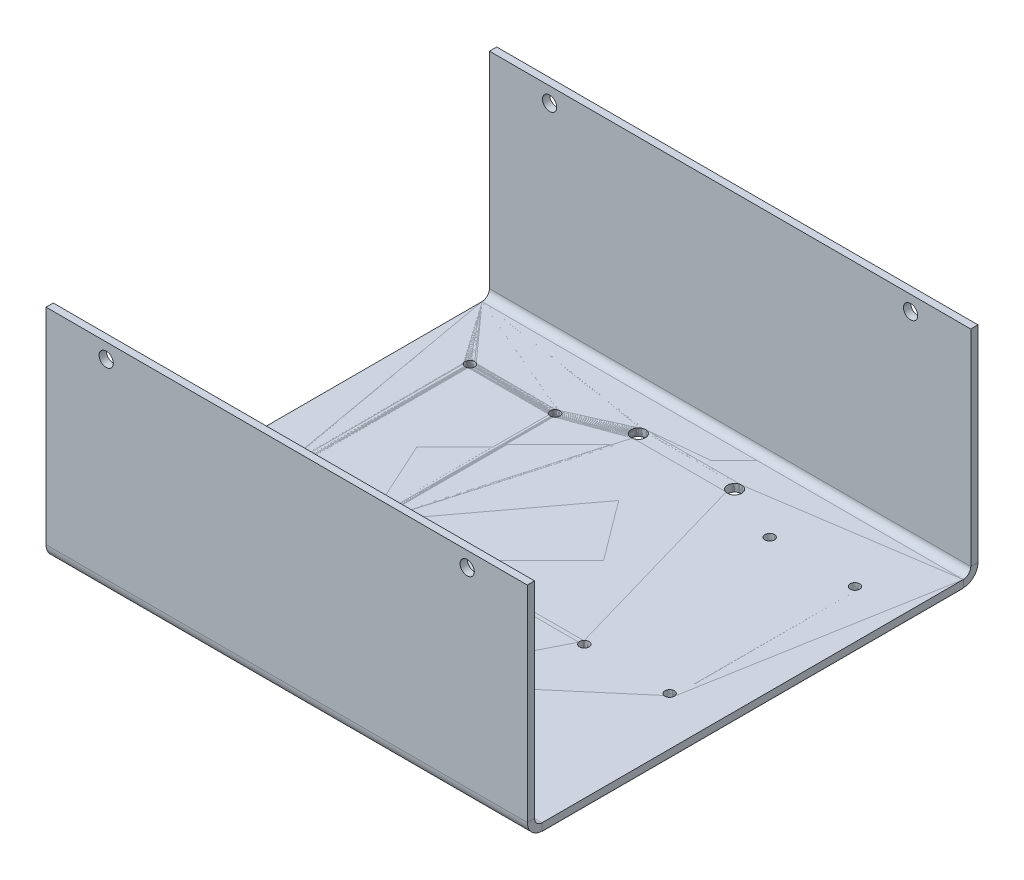
from build123d import *

# Parameters (mm, degrees)
ESQUISSE1_W                      = 101.6
ESQUISSE1_H                      = 88.9
ESQUISSE1_R                      = 1.5
ESQUISSE1_R_2                    = 1
BOSS_EXTRU_1_DEPTH               = 1.5875
CONVERTIR_VOLUME1_START          = 0.0635
CONVERTIR_VOLUME1_OUTLINE_W      = 101.6
CONVERTIR_VOLUME1_OUTLINE_H      = 88.9
CONVERTIR_VOLUME1_OUTLINE_R      = 1.5
CONVERTIR_VOLUME1_OUTLINE_R_2    = 1
CONVERTIR_VOLUME1_DEPTH          = 1.524
T_LE_PLI_E_SUR_AR_TE1_DEPTH      = 101.6
T_LE_START                       = 1.524
T_LE_PLI_E_SUR_AR_TE1_PROFILE_W  = 101.6
T_LE_PLI_E_SUR_AR_TE1_PROFILE_H  = 43.4125
T_LE_PLI_E_SUR_AR_TE1_PROFILE_R  = 1.5
T_LE_PLI_E_SUR_AR_TE1_FLAT_DEPTH = 1.524
T_LE_PLI_E_SUR_AR_TE2_DEPTH      = 101.6
T_LE_PLI_E_SUR_AR_TE2_PROFILE_W  = 101.6
T_LE_PLI_E_SUR_AR_TE2_PROFILE_H  = 43.4125
T_LE_PLI_E_SUR_AR_TE2_PROFILE_R  = 1.5
T_LE_PLI_E_SUR_AR_TE2_FLAT_DEPTH = 1.524


# Read off the part's stored shape, not the designer's step: Convertir-Volume1
# Sheet-metal steps are written as plain solids
with BuildPart() as part:
    # Esquisse1 → Boss.-Extru.1 (new body)
    with BuildSketch(Plane(origin=(0, 0, 0), x_dir=(1, 0, 0), z_dir=(0, 1, 0))):
        with Locations((53.023636364, 35.56)):
            Rectangle(ESQUISSE1_W, ESQUISSE1_H)
        with Locations(Location((63.183636364, 72.39, 0), (0, 0, 270))):
            Circle(ESQUISSE1_R, mode=Mode.SUBTRACT)
        with Locations(Location((63.183636364, 2.54, 0), (0, 0, 270))):
            Circle(ESQUISSE1_R, mode=Mode.SUBTRACT)
        with Locations(Location((75.663636364, 67.31, 0), (0, 0, 270))):
            Circle(ESQUISSE1_R_2, mode=Mode.SUBTRACT)
        with Locations(Location((93.663636364, 67.31, 0), (0, 0, 270))):
            Circle(ESQUISSE1_R_2, mode=Mode.SUBTRACT)
        with Locations(Location((93.663636364, 28.194, 0), (0, 0, 270))):
            Circle(ESQUISSE1_R_2, mode=Mode.SUBTRACT)
        with Locations(Location((75.663636364, 28.194, 0), (0, 0, 270))):
            Circle(ESQUISSE1_R_2, mode=Mode.SUBTRACT)
        with Locations(Location((42.863636364, 2.54, 0), (0, 0, 90))):
            Circle(ESQUISSE1_R, mode=Mode.SUBTRACT)
        with Locations(Location((12.383636364, 28.194, 0), (0, 0, 90))):
            Circle(ESQUISSE1_R_2, mode=Mode.SUBTRACT)
        with Locations(Location((30.383636364, 28.194, 0), (0, 0, 90))):
            Circle(ESQUISSE1_R_2, mode=Mode.SUBTRACT)
        with Locations(Location((12.383636364, 67.31, 0), (0, 0, 90))):
            Circle(ESQUISSE1_R_2, mode=Mode.SUBTRACT)
        with Locations(Location((30.383636364, 67.31, 0), (0, 0, 90))):
            Circle(ESQUISSE1_R_2, mode=Mode.SUBTRACT)
        with Locations(Location((42.863636364, 72.39, 0), (0, 0, 90))):
            Circle(ESQUISSE1_R, mode=Mode.SUBTRACT)
    extrude(amount=BOSS_EXTRU_1_DEPTH)


with BuildPart() as body_2:
    # Convertir-Volume1 outline → Convertir-Volume1 (new body)
    with BuildSketch(Plane(origin=(0, 0, 0), x_dir=(1, 0, 0), z_dir=(0, 1, 0)).offset(CONVERTIR_VOLUME1_START)):
        with Locations((53.023636364, 35.56)):
            Rectangle(CONVERTIR_VOLUME1_OUTLINE_W, CONVERTIR_VOLUME1_OUTLINE_H)
        with Locations((42.863636364, 2.54)):
            Circle(CONVERTIR_VOLUME1_OUTLINE_R, mode=Mode.SUBTRACT)
        with Locations((12.383636364, 28.194)):
            Circle(CONVERTIR_VOLUME1_OUTLINE_R_2, mode=Mode.SUBTRACT)
        with Locations((30.383636364, 28.194)):
            Circle(CONVERTIR_VOLUME1_OUTLINE_R_2, mode=Mode.SUBTRACT)
        with Locations((63.183636364, 2.54)):
            Circle(CONVERTIR_VOLUME1_OUTLINE_R, mode=Mode.SUBTRACT)
        with Locations((75.663636364, 28.194)):
            Circle(CONVERTIR_VOLUME1_OUTLINE_R_2, mode=Mode.SUBTRACT)
        with Locations((93.663636364, 28.194)):
            Circle(CONVERTIR_VOLUME1_OUTLINE_R_2, mode=Mode.SUBTRACT)
        with Locations((12.383636364, 67.31)):
            Circle(CONVERTIR_VOLUME1_OUTLINE_R_2, mode=Mode.SUBTRACT)
        with Locations((30.383636364, 67.31)):
            Circle(CONVERTIR_VOLUME1_OUTLINE_R_2, mode=Mode.SUBTRACT)
        with Locations((42.863636364, 72.39)):
            Circle(CONVERTIR_VOLUME1_OUTLINE_R, mode=Mode.SUBTRACT)
        with Locations((75.663636364, 67.31)):
            Circle(CONVERTIR_VOLUME1_OUTLINE_R_2, mode=Mode.SUBTRACT)
        with Locations((63.183636364, 72.39)):
            Circle(CONVERTIR_VOLUME1_OUTLINE_R, mode=Mode.SUBTRACT)
        with Locations((93.663636364, 67.31)):
            Circle(CONVERTIR_VOLUME1_OUTLINE_R_2, mode=Mode.SUBTRACT)
    extrude(amount=CONVERTIR_VOLUME1_DEPTH)

    # Tôle pliée sur arête1 bend section (across the edge) → Tôle pliée sur arête1 (add)
    with BuildSketch(Plane(origin=(2.223636364, 1.5875, 10.4775), x_dir=(0, 0, -1), z_dir=(1, 0, 0))):
        with BuildLine():
            Line((-1.524, 1.5875), (0, 1.5875))
            ThreePointArc((0, 1.5875), (0.464967985, 0.464967985), (1.5875, 0))
            Line((1.5875, 0), (1.5875, -1.524))
            ThreePointArc((1.5875, -1.524), (-0.61266275, -0.61266275), (-1.524, 1.5875))
        make_face()
    extrude(amount=T_LE_PLI_E_SUR_AR_TE1_DEPTH)

    # Tôle pliée sur arête1 profile (on flange) → Tôle pliée sur arête1 flat (add)
    with BuildSketch(Plane(origin=(0, 1.5875, 10.4775), x_dir=(1, 0, 0), z_dir=(0, 0, 1)).offset(T_LE_START)):
        with Locations((53.023636364, 23.29375)):
            Rectangle(T_LE_PLI_E_SUR_AR_TE1_PROFILE_W, T_LE_PLI_E_SUR_AR_TE1_PROFILE_H)
        with Locations((14.923636364, 41.825)):
            Circle(T_LE_PLI_E_SUR_AR_TE1_PROFILE_R, mode=Mode.SUBTRACT)
        with Locations((91.123636364, 41.825)):
            Circle(T_LE_PLI_E_SUR_AR_TE1_PROFILE_R, mode=Mode.SUBTRACT)
    extrude(amount=-T_LE_PLI_E_SUR_AR_TE1_FLAT_DEPTH)

    # Tôle pliée sur arête2 bend section (across the edge) → Tôle pliée sur arête2 (add)
    with BuildSketch(Plane(origin=(103.823636364, 1.5875, -81.5975), x_dir=(0, 0, 1), z_dir=(-1, 0, 0))):
        with BuildLine():
            Line((-1.524, 1.5875), (0, 1.5875))
            ThreePointArc((0, 1.5875), (0.464967985, 0.464967985), (1.5875, 0))
            Line((1.5875, 0), (1.5875, -1.524))
            ThreePointArc((1.5875, -1.524), (-0.61266275, -0.61266275), (-1.524, 1.5875))
        make_face()
    extrude(amount=T_LE_PLI_E_SUR_AR_TE2_DEPTH)

    # Tôle pliée sur arête2 profile (on flange) → Tôle pliée sur arête2 flat (add)
    with BuildSketch(Plane(origin=(0, 1.5875, -81.5975), x_dir=(-1, 0, 0), z_dir=(0, 0, -1)).offset(T_LE_START)):
        with Locations((-53.023636364, 23.29375)):
            Rectangle(T_LE_PLI_E_SUR_AR_TE2_PROFILE_W, T_LE_PLI_E_SUR_AR_TE2_PROFILE_H)
        with Locations((-14.923636364, 41.825)):
            Circle(T_LE_PLI_E_SUR_AR_TE2_PROFILE_R, mode=Mode.SUBTRACT)
        with Locations((-91.123636364, 41.825)):
            Circle(T_LE_PLI_E_SUR_AR_TE2_PROFILE_R, mode=Mode.SUBTRACT)
    extrude(amount=-T_LE_PLI_E_SUR_AR_TE2_FLAT_DEPTH)


solid = Compound([part.part, body_2.part])
